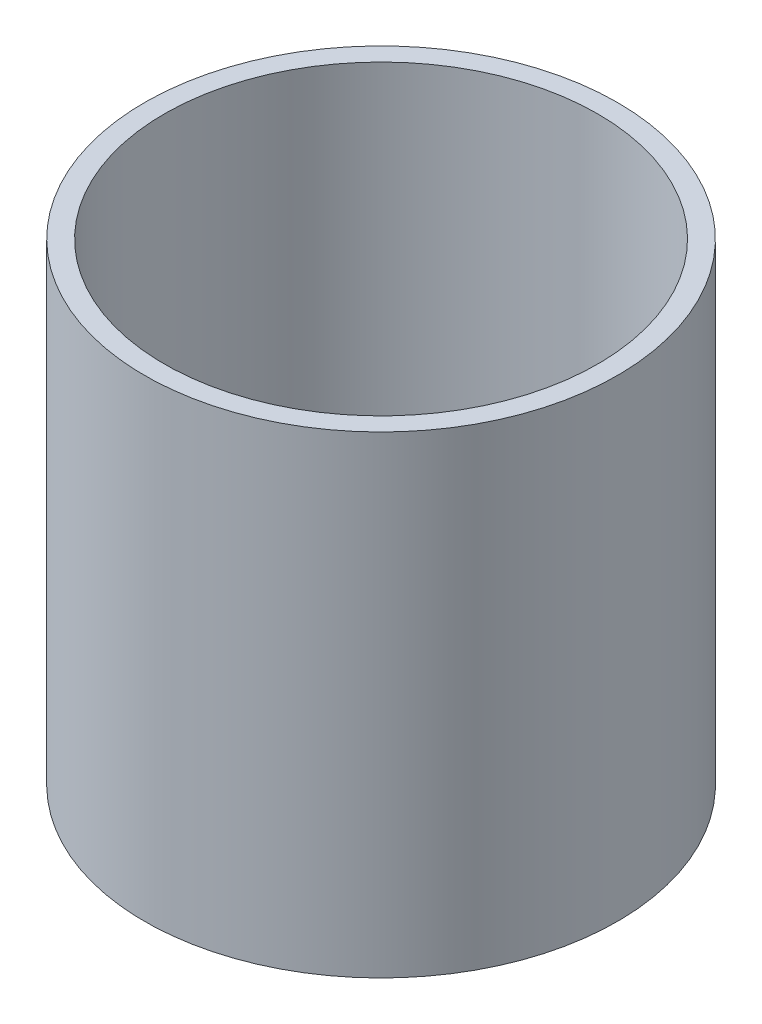
from build123d import *

# Parameters (mm, degrees)
SKETCH_1_R      = 60
SKETCH_1_R_2    = 55
EXTRUDE_1_DEPTH = 120


with BuildPart() as part:
    # Эскиз1 → Вытянуть-Тонкостенный1 (new body)
    with BuildSketch(Plane(origin=(0, 0, 0), x_dir=(1, 0, 0), z_dir=(0, 1, 0))):
        Circle(SKETCH_1_R)
        Circle(SKETCH_1_R_2, mode=Mode.SUBTRACT)
    extrude(amount=EXTRUDE_1_DEPTH)


solid = part.part
